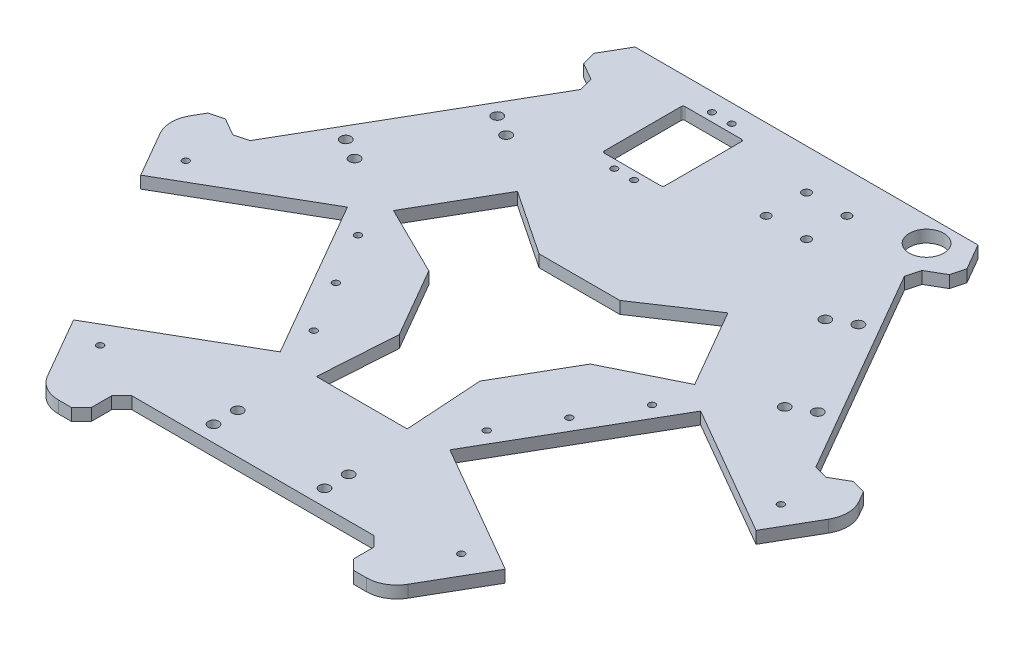
from build123d import *

# Parameters (mm, degrees)
EXTRUDE_1_DEPTH             = 6
CUT_EXTRUDE_31_REACH        = 226.969
SKETCH_46_W                 = 130
SKETCH_46_H                 = 20
SKETCH_8_R                  = 2.6
CUT_EXTRUDE_6_DEPTH         = 225.968886738
PATTERN_CIRCULAR_1_COUNT    = 3
CHAMFER_1_SIZE              = 5
CUT_EXTRUDE_4_DEPTH         = 225.968886738
SKETCH_9_R                  = 1.65
CUT_EXTRUDE_7_DEPTH         = 225.968886738
FILLET_1_R                  = 15
M4X0_7_4_D                  = 3.3
CUT_EXTRUDE_35_REACH        = 225.221
CUT_EXTRUDE_36_REACH        = 225.221
CUT_EXTRUDE_37_REACH        = 225.221
SKETCH_53_R                 = 2.1
PATTERN_LINEAR_1_COUNT      = 2
PATTERN_LINEAR_1_PITCH      = 20
PATTERN_LINEAR_1_COUNT_DIR2 = 2
PATTERN_LINEAR_1_PITCH_DIR2 = 20
CUT_EXTRUDE_38_REACH        = 225.221
SKETCH_54_R                 = 8.55
SKETCH_56_R                 = 1.6
CUT_EXTRUDE_40_DEPTH        = 10
SKETCH_55_W                 = 30
SKETCH_55_H                 = 40
CUT_EXTRUDE_39_DEPTH        = 10
FILLET_2_R                  = 1


with BuildPart() as part:
    # 草圖1 → 填料-伸長1 (new body)
    with BuildSketch(Plane(origin=(0, 0, 0), x_dir=(1, 0, 0), z_dir=(0, 1, 0))):
        Polygon((85, 147.224318643), (-85, 147.224318643), (-170, 0), (-85, -147.224318643), (85, -147.224318643), (170, 0), align=None)
    extrude(amount=EXTRUDE_1_DEPTH)

    # 草圖46 → 除料-伸長31 (cut, up to next)
    with BuildSketch(Plane(origin=(0, 6, 0), x_dir=(1, 0, 0), z_dir=(0, 1, 0)), mode=Mode.PRIVATE) as cut_extrude_31_sk1:
        with Locations((0, -137.224318643)):
            Rectangle(SKETCH_46_W, SKETCH_46_H)
    cut_extrude_31_tool1 = extrude(cut_extrude_31_sk1.sketch, amount=-CUT_EXTRUDE_31_REACH, mode=Mode.PRIVATE) & part.part
    cut_extrude_31 = cut_extrude_31_tool1.solids().sort_by_distance((0, 6, 137.224319))[0]
    add(cut_extrude_31, mode=Mode.SUBTRACT)

    # 草圖8 → 除料-伸長6 (cut, through all)
    with BuildSketch(Plane(origin=(0, 6, 0), x_dir=(1, 0, 0), z_dir=(0, 1, 0))):
        with Locations((-27.5, -119.224318643)):
            Circle(SKETCH_8_R)
        with Locations((27.5, -119.224318643)):
            Circle(SKETCH_8_R)
        with Locations((-27.5, -107.224318643)):
            Circle(SKETCH_8_R)
        with Locations((27.5, -107.224318643)):
            Circle(SKETCH_8_R)
    cut_extrude_6 = extrude(amount=-CUT_EXTRUDE_6_DEPTH, mode=Mode.SUBTRACT)

    # 環狀複製排列1: 除料-伸長31, 除料-伸長6 ×3 about axis
    pattern_circular_1_axis = Axis((0, -0.25, 0), (0, 1, 0))
    add([cut_extrude_31.rotate(pattern_circular_1_axis, i * 360 / PATTERN_CIRCULAR_1_COUNT) for i in range(1, PATTERN_CIRCULAR_1_COUNT)], mode=Mode.SUBTRACT)
    add([cut_extrude_6.rotate(pattern_circular_1_axis, i * 360 / PATTERN_CIRCULAR_1_COUNT) for i in range(1, PATTERN_CIRCULAR_1_COUNT)], mode=Mode.SUBTRACT)

    # 導角1
    chamfer_1_edges = [part.edges().sort_by_distance(p)[0] for p in [
        (65, 3, 127.224318643),
        (65, 3, 147.224318643),
        (-65, 3, 147.224318643),
        (-65, 3, 127.224318643),
        (77.679491924, 3, -119.903810568),
        (95, 3, -129.903810568),
        (160, 3, -17.320508076),
        (142.679491924, 3, -7.320508076),
        (-160, 3, -17.320508076),
        (-142.679491924, 3, -7.320508076),
        (-77.679491924, 3, -119.903810568),
        (-95, 3, -129.903810568),
    ]]
    chamfer(chamfer_1_edges, length=CHAMFER_1_SIZE)

    # 草圖5 → 除料-伸長4 (cut, through all)
    with BuildSketch(Plane(origin=(0, 6, 0), x_dir=(1, 0, 0), z_dir=(0, 1, 0))):
        Polygon((-152.5, -30.310889132), (-107, -109.119200877), (-42.048094716, -71.619200877), (-87.548094716, 7.189110868), align=None)
    cut_extrude_4 = extrude(amount=-CUT_EXTRUDE_4_DEPTH, mode=Mode.SUBTRACT)

    # 草圖9 → 除料-伸長7 (cut, through all)
    with BuildSketch(Plane(origin=(0, 6, 0), x_dir=(1, 0, 0), z_dir=(0, 1, 0))):
        with Locations((-89.491669751, -113.444518424)):
            Circle(SKETCH_9_R)
        with Locations((-147.491669751, -12.985571585)):
            Circle(SKETCH_9_R)
    cut_extrude_7 = extrude(amount=-CUT_EXTRUDE_7_DEPTH, mode=Mode.SUBTRACT)

    # 鏡射1: 除料-伸長4, 除料-伸長7 across plane
    add(cut_extrude_4.mirror(Plane(origin=(0, 0, 0), x_dir=(0, 0, 1), z_dir=(1, 0, 0))), mode=Mode.SUBTRACT)
    add(cut_extrude_7.mirror(Plane(origin=(0, 0, 0), x_dir=(0, 0, 1), z_dir=(1, 0, 0))), mode=Mode.SUBTRACT)

    # 圓角1
    fillet_1_edges = [part.edges().sort_by_distance(p)[0] for p in [
        (170, 3, 0),
        (85, 3, 147.224318643),
        (-170, 3, 0),
        (-85, 3, 147.224318643),
    ]]
    fillet(fillet_1_edges, radius=FILLET_1_R)

    # M4x0.7 螺紋孔4 (through all)
    with Locations(Plane(origin=(0, 6, 0), x_dir=(1, 0, 0), z_dir=(0, 1, 0))):
        with Locations((-72.869891486, -2.234282891), (-57.869891486, -28.215045005), (-42.869891486, -54.195807118)):
            m4x0_7_4 = Hole(M4X0_7_4_D / 2)

    # 鏡射2: M4x0.7 螺紋孔4 across plane
    add(m4x0_7_4.mirror(Plane(origin=(0, 0, 0), x_dir=(0, 0, 1), z_dir=(1, 0, 0))), mode=Mode.SUBTRACT)

    # 草圖51 → 除料-伸長35 (cut, up to next)
    with BuildSketch(Plane(origin=(0, 6, 0), x_dir=(1, 0, 0), z_dir=(0, 1, 0)), mode=Mode.PRIVATE) as cut_extrude_35_sk1:
        Polygon((20, 34.641016151), (-20, 34.641016151), (-40, 0), (-20, -34.641016151), (20, -34.641016151), (40, 0), align=None)
    cut_extrude_35_tool1 = extrude(cut_extrude_35_sk1.sketch, amount=-CUT_EXTRUDE_35_REACH, mode=Mode.PRIVATE) & part.part
    add(cut_extrude_35_tool1.solids().sort_by_distance((0, 6, 0))[0], mode=Mode.SUBTRACT)

    # 草圖52 → 除料-伸長36 (cut, up to next)
    with BuildSketch(Plane(origin=(0, 6, 0), x_dir=(1, 0, 0), z_dir=(0, 1, 0)), mode=Mode.PRIVATE) as cut_extrude_36_sk1:
        Polygon((-22.5, -73.224318643), (22.5, -73.224318643), (20, -34.641016151), (-20, -34.641016151), align=None)
    cut_extrude_36_tool1 = extrude(cut_extrude_36_sk1.sketch, amount=-CUT_EXTRUDE_36_REACH, mode=Mode.PRIVATE) & part.part
    # 草圖52 → 除料-伸長36 (cut, up to next)
    with BuildSketch(Plane(origin=(0, 6, 0), x_dir=(1, 0, 0), z_dir=(0, 1, 0)), mode=Mode.PRIVATE) as cut_extrude_36_sk2:
        Polygon((-20, 34.641016151), (-52.16412012, 56.097730907), (-74.66412012, 17.126587737), (-40, 0), align=None)
    cut_extrude_36_tool2 = extrude(cut_extrude_36_sk2.sketch, amount=-CUT_EXTRUDE_36_REACH, mode=Mode.PRIVATE) & part.part
    # 草圖52 → 除料-伸長36 (cut, up to next)
    with BuildSketch(Plane(origin=(0, 6, 0), x_dir=(1, 0, 0), z_dir=(0, 1, 0)), mode=Mode.PRIVATE) as cut_extrude_36_sk3:
        Polygon((40, 0), (74.66412012, 17.126587737), (52.16412012, 56.097730907), (20, 34.641016151), align=None)
    cut_extrude_36_tool3 = extrude(cut_extrude_36_sk3.sketch, amount=-CUT_EXTRUDE_36_REACH, mode=Mode.PRIVATE) & part.part
    add(cut_extrude_36_tool1.solids().sort_by_distance((0, 6, 54.310935))[0], mode=Mode.SUBTRACT)
    add(cut_extrude_36_tool2.solids().sort_by_distance((-47.034649, 6, -27.155468))[0], mode=Mode.SUBTRACT)
    add(cut_extrude_36_tool3.solids().sort_by_distance((47.034649, 6, -27.155468))[0], mode=Mode.SUBTRACT)

    # 草圖53 → 除料-伸長37 (cut, up to next)
    with BuildSketch(Plane(origin=(0, 6, 0), x_dir=(1, 0, 0), z_dir=(0, 1, 0)), mode=Mode.PRIVATE) as cut_extrude_37_sk1:
        with Locations((20, 127.224318643)):
            Circle(SKETCH_53_R)
    cut_extrude_37_tool1 = extrude(cut_extrude_37_sk1.sketch, amount=-CUT_EXTRUDE_37_REACH, mode=Mode.PRIVATE) & part.part
    cut_extrude_37 = cut_extrude_37_tool1.solids().sort_by_distance((20, 6, -127.224319))[0]
    add(cut_extrude_37, mode=Mode.SUBTRACT)

    # 直線複製排列1: Cut-Extrude 37 2 × 2
    with Locations(*[(i * PATTERN_LINEAR_1_PITCH, 0, j * PATTERN_LINEAR_1_PITCH_DIR2) for i in range(PATTERN_LINEAR_1_COUNT) for j in range(PATTERN_LINEAR_1_COUNT_DIR2) if (i, j) != (0, 0)]):
        add(cut_extrude_37, mode=Mode.SUBTRACT)

    # 草圖54 → 除料-伸長38 (cut, up to next)
    with BuildSketch(Plane(origin=(0, 6, 0), x_dir=(1, 0, 0), z_dir=(0, 1, 0)), mode=Mode.PRIVATE) as cut_extrude_38_sk1:
        with Locations((71.5, 135.224318643)):
            Circle(SKETCH_54_R)
    cut_extrude_38_tool1 = extrude(cut_extrude_38_sk1.sketch, amount=-CUT_EXTRUDE_38_REACH, mode=Mode.PRIVATE) & part.part
    add(cut_extrude_38_tool1.solids().sort_by_distance((71.5, 6, -135.224319))[0], mode=Mode.SUBTRACT)

    # 草圖56 → 除料-伸長40 (cut)
    with BuildSketch(Plane(origin=(0, 0, 0), x_dir=(-1, 0, 0), z_dir=(0, -1, 0))):
        with Locations((28.1, 138.224318643)):
            Circle(SKETCH_56_R)
        with Locations((37.9, 138.224318643)):
            Circle(SKETCH_56_R)
        with Locations((37.9, 89.824318643)):
            Circle(SKETCH_56_R)
        with Locations((28.1, 89.824318643)):
            Circle(SKETCH_56_R)
    extrude(amount=-CUT_EXTRUDE_40_DEPTH, mode=Mode.SUBTRACT)

    # 草圖55 → 除料-伸長39 (cut)
    with BuildSketch(Plane(origin=(0, 6, 0), x_dir=(1, 0, 0), z_dir=(0, 1, 0))):
        with Locations((-33, 114.024318643)):
            Rectangle(SKETCH_55_W, SKETCH_55_H)
    extrude(amount=-CUT_EXTRUDE_39_DEPTH, mode=Mode.SUBTRACT)

    # 圓角2
    fillet_2_edges = [part.edges().sort_by_distance(p)[0] for p in [
        (-48, 3, -94.024318643),
        (-18, 3, -94.024318643),
        (-18, 3, -134.024318643),
        (-48, 3, -134.024318643),
    ]]
    fillet(fillet_2_edges, radius=FILLET_2_R)


solid = part.part
